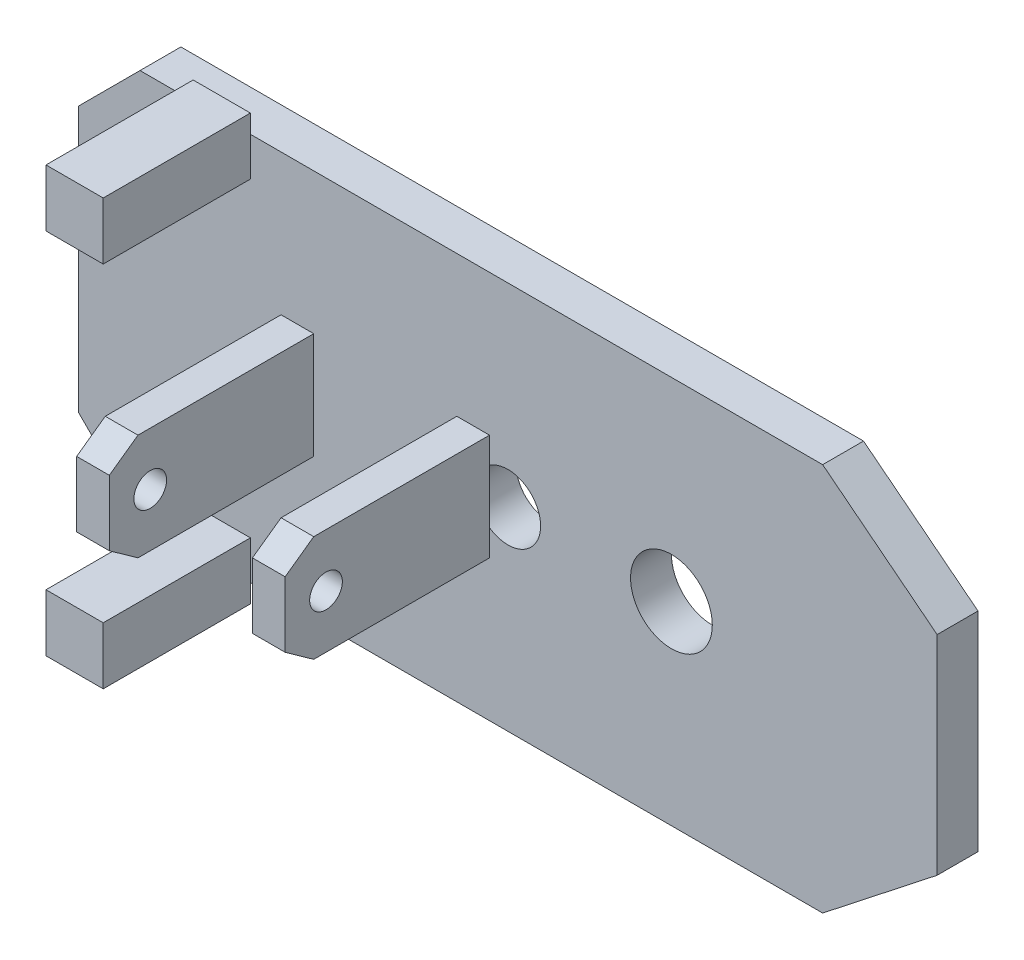
from build123d import *

# Parameters (mm, degrees)
SK_SOLE_PLATE_R    = 10
SK_SOLE_PLATE_R_2  = 8
SOLE_PLATE_DEPTH   = 10
SK_CLEVIS_FRONT_R  = 4
CLEVIS_FRONT_DEPTH = 8
SK_CLEVIS_BACK_R   = 4
CLEVIS_BACK_DEPTH  = 8
SK_POST_LAT_W      = 14
SK_POST_LAT_H      = 14
POST_LAT_DEPTH     = 36
SK_POST_MED_W      = 14
SK_POST_MED_H      = 14
POST_MED_DEPTH     = 36


with BuildPart() as part:
    # SK_Sole_Plate → Sole_Plate (new body)
    with BuildSketch(Plane.XY.offset(-50)):
        Polygon((-60, -47.5), (107, -47.5), (135, -25.5), (135, 25.5), (107, 47.5), (-60, 47.5), (-75, 32.5), (-75, -32.5), align=None)
        with Locations((70, 0)):
            Circle(SK_SOLE_PLATE_R, mode=Mode.SUBTRACT)
        with Locations((30, 0)):
            Circle(SK_SOLE_PLATE_R_2, mode=Mode.SUBTRACT)
    extrude(amount=SOLE_PLATE_DEPTH)

    # SK_Clevis_Front → Clevis_Front (add)
    with BuildSketch(Plane(origin=(17.5, 0, 0), x_dir=(0, 0, -1), z_dir=(1, 0, 0))):
        Polygon((40, -13), (40, 13), (-3, 13), (-10, 8), (-10, -8), (-3, -13), align=None)
        Circle(SK_CLEVIS_FRONT_R, mode=Mode.SUBTRACT)
    extrude(amount=CLEVIS_FRONT_DEPTH)

    # SK_Clevis_Back → Clevis_Back (add)
    with BuildSketch(Plane(origin=(-25.5, 0, 0), x_dir=(0, 0, -1), z_dir=(1, 0, 0))):
        Polygon((40, -13), (40, 13), (-3, 13), (-10, 8), (-10, -8), (-3, -13), align=None)
        Circle(SK_CLEVIS_BACK_R, mode=Mode.SUBTRACT)
    extrude(amount=CLEVIS_BACK_DEPTH)

    # SK_Post_Lat → Post_Lat (add)
    with BuildSketch(Plane.XY.offset(-40)):
        with Locations((-40, 45)):
            Rectangle(SK_POST_LAT_W, SK_POST_LAT_H)
    extrude(amount=POST_LAT_DEPTH)

    # SK_Post_Med → Post_Med (add)
    with BuildSketch(Plane.XY.offset(-40)):
        with Locations((-40, -45)):
            Rectangle(SK_POST_MED_W, SK_POST_MED_H)
    extrude(amount=POST_MED_DEPTH)


solid = part.part
